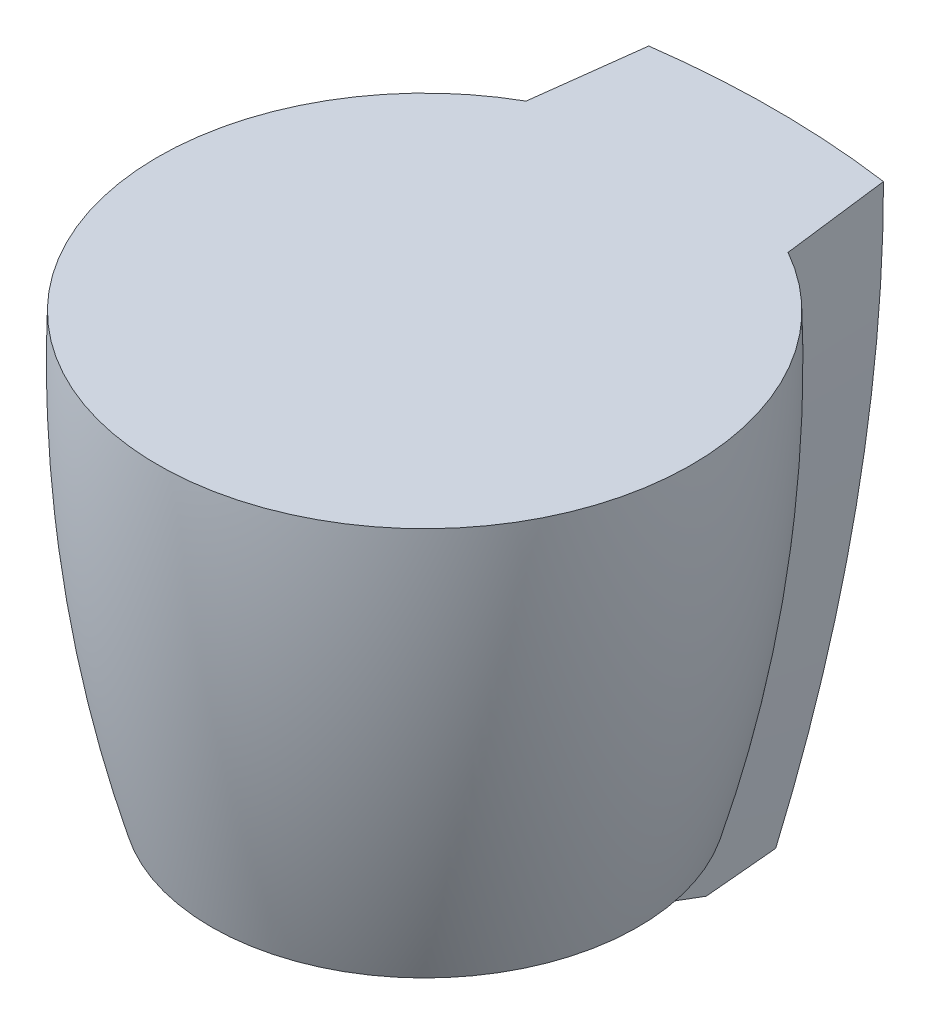
from build123d import *

# Parameters (mm, degrees)
CUT_EXTRUDE_1_DEPTH      = 67.373183556
CUT_EXTRUDE_1_DEPTH_BACK = 67.373183556


# Read off the part's stored shape, not the designer's step: Поверхность-Сшить1
with BuildPart() as part:
    # Knit 1 outline → Knit 1 (revolve)
    with BuildSketch(Plane.XY):
        with BuildLine():
            Line((0, 0), (0, -40))
            Line((0, -40), (20, -40))
            ThreePointArc((20, -40), (24.059865396, -20.194983175), (25, 0))
            Line((25, 0), (0, 0))
        make_face()
    revolve(axis=Axis((0, 0, 0), (0, 1, 0)))

    # По траектории1: sweep along a path in Эскиз3
    with BuildLine(Plane(origin=(0, 0, 0), x_dir=(0, 0, -1), z_dir=(1, 0, 0))) as sweep_1_path:
        ThreePointArc((32.759858657, 0), (29.894665497, -26.609940967), (21.430435325, -52))
    # Эскиз2 → По траектории1 (sweep)
    with BuildSketch(Plane(origin=(0, 0, 0), x_dir=(1, 0, 0), z_dir=(0, 1, 0))):
        with BuildLine():
            Line((-15, 0), (15, 0))
            Line((15, 0), (11, 32))
            ThreePointArc((11, 32), (0, 32.759858657), (-11, 32))
            Line((-11, 32), (-15, 0))
        make_face()
    sweep(path=sweep_1_path.line)

    # Эскиз4 → Вырез-Вытянуть1 (cut, two sides: drawn at the far end of the back side and taken through both)
    with BuildSketch(Plane.XY.offset(-CUT_EXTRUDE_1_DEPTH_BACK)):
        with BuildLine():
            Line((145.597430233, 60.060046505), (31.407892686, -38.452179183))
            ThreePointArc((31.407892686, -38.452179183), (-1.252964611, -50.593647771), (-33.913821908, -38.452179183))
            Line((-33.913821908, -38.452179183), (-148.103359455, 60.060046505))
            Line((-148.103359455, 60.060046505), (-148.103359455, -241.561631066))
            Line((-148.103359455, -241.561631066), (145.597430233, -241.561631066))
            Line((145.597430233, -241.561631066), (145.597430233, 60.060046505))
        make_face()
    extrude(amount=CUT_EXTRUDE_1_DEPTH + CUT_EXTRUDE_1_DEPTH_BACK, mode=Mode.SUBTRACT)


solid = part.part
